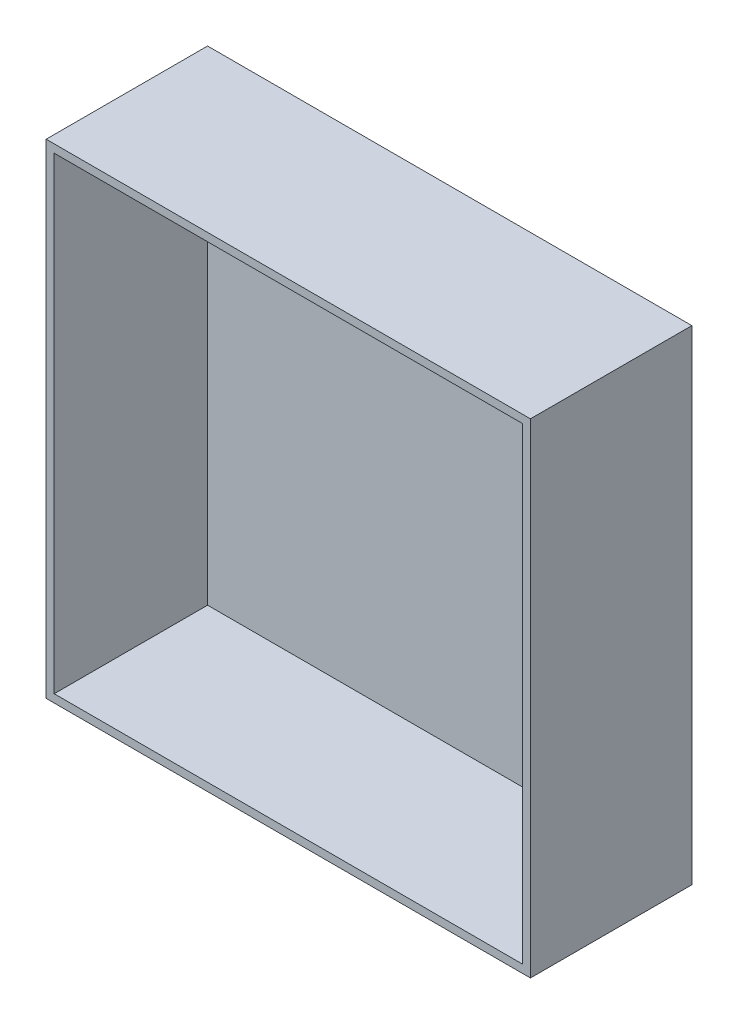
from build123d import *

# Parameters (mm, degrees)
SKETCH_1_W          = 300
SKETCH_1_H          = 300
EXTRUDE_1_DEPTH     = 100
SKETCH_2_W          = 290
SKETCH_2_H          = 290
CUT_EXTRUDE_1_DEPTH = 95


with BuildPart() as part:
    # ｽｹｯﾁ1 → ﾎﾞｽ - 押し出し1 (new body)
    with BuildSketch(Plane.XY):
        with Locations((150, -150)):
            Rectangle(SKETCH_1_W, SKETCH_1_H)
    extrude(amount=EXTRUDE_1_DEPTH)

    # ｽｹｯﾁ2 → ｶｯﾄ - 押し出し1 (cut)
    with BuildSketch(Plane.XY.offset(100)):
        with Locations((150, -150)):
            Rectangle(SKETCH_2_W, SKETCH_2_H)
    extrude(amount=-CUT_EXTRUDE_1_DEPTH, mode=Mode.SUBTRACT)


solid = part.part
